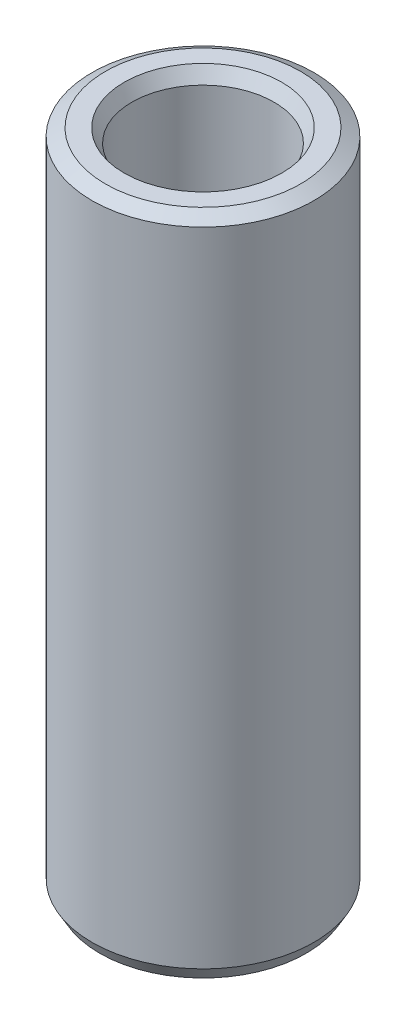
from build123d import *
from OCP.BRepFilletAPI import BRepFilletAPI_MakeChamfer

# Parameters (mm, degrees)
SKETCH1_R           = 42.5
BOSS_EXTRUDE1_DEPTH = 254.113138222
SKETCH2_R           = 27.211543971
CUT_EXTRUDE1_DEPTH  = 262.124466523
CHAMFER1_SIZE       = 2.958433986
CHAMFER1_SIZE2      = 5.124157975


with BuildPart() as part:
    # Sketch1 → Boss-Extrude1 (new body)
    with BuildSketch(Plane(origin=(0, 0, 0), x_dir=(1, 0, 0), z_dir=(0, 1, 0))):
        Circle(SKETCH1_R)
    extrude(amount=BOSS_EXTRUDE1_DEPTH)

    # Sketch2 → Cut-Extrude1 (cut, through all)
    with BuildSketch(Plane(origin=(0, 0, 0), x_dir=(1, 0, 0), z_dir=(0, 1, 0))):
        Circle(SKETCH2_R)
    extrude(amount=CUT_EXTRUDE1_DEPTH, mode=Mode.SUBTRACT)

    # Chamfer1: one chamfer whose edges measure the first distance from different faces: ONE call of the kernel's chamfer builder (chamfer() names one face for all edges)
    chamfer1_edges_1 = [part.edges().sort_by_distance(p)[0] for p in [
        (-27.211543971, 254.113138222, 0),
    ]]
    chamfer1_side_1 = [part.faces().sort_by_distance(p)[0] for p in [
        (-41.297918472, 254.113138222, 0),
    ]]
    chamfer1_edges_2 = [part.edges().sort_by_distance(p)[0] for p in [
        (-27.211543971, 0, 0),
    ]]
    chamfer1_side_2 = [part.faces().sort_by_distance(p)[0] for p in [
        (-27.211543971, 127.056569111, 0),
    ]]
    chamfer1_edges_3 = [part.edges().sort_by_distance(p)[0] for p in [
        (-42.5, 0, 0),
    ]]
    chamfer1_side_3 = [part.faces().sort_by_distance(p)[0] for p in [
        (-41.297918472, 0, 0),
    ]]
    chamfer1_edges_4 = [part.edges().sort_by_distance(p)[0] for p in [
        (-42.5, 254.113138222, 0),
    ]]
    chamfer1_side_4 = [part.faces().sort_by_distance(p)[0] for p in [
        (-42.5, 127.056569111, 0),
    ]]
    chamfer1 = BRepFilletAPI_MakeChamfer(part.part.solid().wrapped)
    for e in chamfer1_edges_1:
        chamfer1.Add(CHAMFER1_SIZE, CHAMFER1_SIZE2, e.wrapped, chamfer1_side_1[0].wrapped)  # the first distance lies on this face
    for e in chamfer1_edges_2:
        chamfer1.Add(CHAMFER1_SIZE, CHAMFER1_SIZE2, e.wrapped, chamfer1_side_2[0].wrapped)  # the first distance lies on this face
    for e in chamfer1_edges_3:
        chamfer1.Add(CHAMFER1_SIZE, CHAMFER1_SIZE2, e.wrapped, chamfer1_side_3[0].wrapped)  # the first distance lies on this face
    for e in chamfer1_edges_4:
        chamfer1.Add(CHAMFER1_SIZE, CHAMFER1_SIZE2, e.wrapped, chamfer1_side_4[0].wrapped)  # the first distance lies on this face
    add(Compound.cast(chamfer1.Shape()), mode=Mode.REPLACE)


solid = part.part
